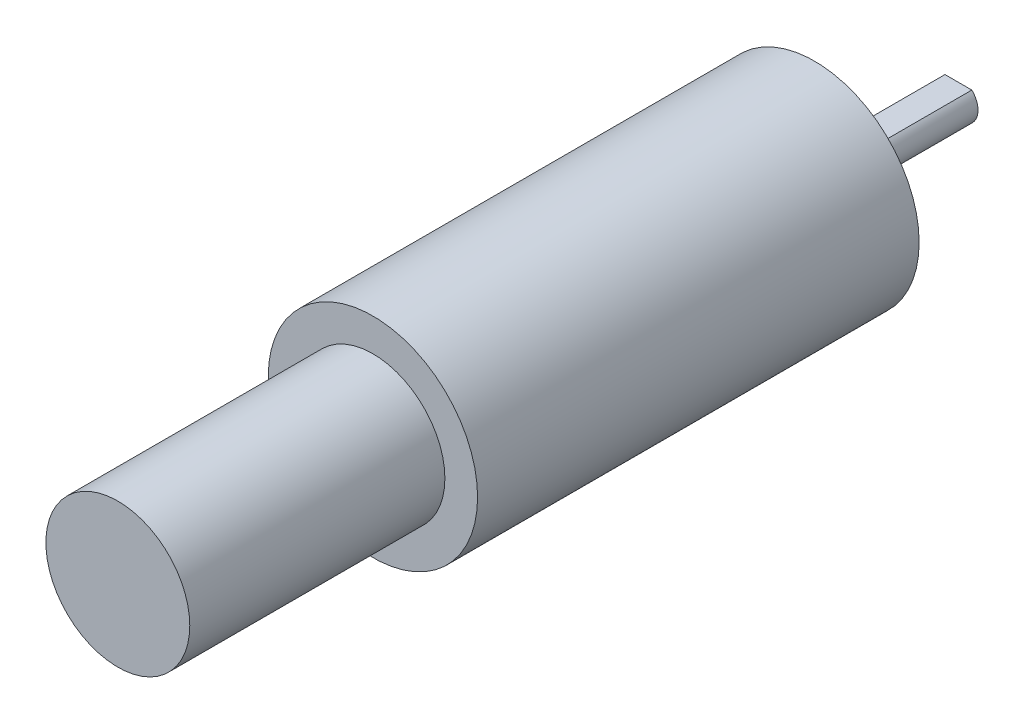
from build123d import *

# Parameters (mm, degrees)
SKETCH1_R           = 16
BOSS_EXTRUDE1_DEPTH = 67.5
SKETCH2_R           = 9
BOSS_EXTRUDE2_DEPTH = 1
SKETCH3_R           = 3
BOSS_EXTRUDE3_DEPTH = 21
CUT_EXTRUDE1_DEPTH  = 17.698
SKETCH5_R           = 11
BOSS_EXTRUDE4_DEPTH = 39
CIRPATTERN1_COUNT   = 4


with BuildPart() as part:
    # Sketch1 → Boss-Extrude1 (new body)
    with BuildSketch(Plane.XY):
        Circle(SKETCH1_R)
    extrude(amount=BOSS_EXTRUDE1_DEPTH)

    # Sketch2 → Boss-Extrude2 (add)
    with BuildSketch(Plane(origin=(0, 0, 0), x_dir=(-1, 0, 0), z_dir=(0, 0, -1))):
        Circle(SKETCH2_R)
    extrude(amount=BOSS_EXTRUDE2_DEPTH)

    # Sketch3 → Boss-Extrude3 (add)
    with BuildSketch(Plane(origin=(0, 0, -1), x_dir=(-1, 0, 0), z_dir=(0, 0, -1))):
        Circle(SKETCH3_R)
    extrude(amount=BOSS_EXTRUDE3_DEPTH)

    # Sketch4 → Cut-Extrude1 (cut)
    with BuildSketch(Plane(origin=(0, 0, -22), x_dir=(-1, 0, 0), z_dir=(0, 0, -1))):
        Polygon((-3.161861974, 2.187315475), (3.465054218, 2.187315475), (3.465054218, 5.609056515), align=None)
    extrude(amount=-CUT_EXTRUDE1_DEPTH, mode=Mode.SUBTRACT)

    # Sketch5 → Boss-Extrude4 (add)
    with BuildSketch(Plane.XY.offset(67.5)):
        Circle(SKETCH5_R)
    extrude(amount=BOSS_EXTRUDE4_DEPTH)

    # Sketch8 → M3x0.5 Tapped Hole1 (revolve, cut)
    with BuildSketch(Plane(origin=(0, 13, 0), x_dir=(0, 1, 0), z_dir=(1, 0, 0))):
        Polygon((0, 0), (0, 8.371075774), (1.25, 7.62), (1.25, 0), align=None)
    m3x0_5_tapped_hole1 = revolve(axis=Axis((0, 13, -6.35), (0, 0, 1)), mode=Mode.SUBTRACT)

    # CirPattern1: M3x0.5 Tapped Hole1 ×4 about axis
    cirpattern1_axis = Axis((0, 0, 67.5), (0, 0, -1))
    for i in range(1, CIRPATTERN1_COUNT):
        add(m3x0_5_tapped_hole1.rotate(cirpattern1_axis, i * 360 / CIRPATTERN1_COUNT), mode=Mode.SUBTRACT)


solid = part.part
